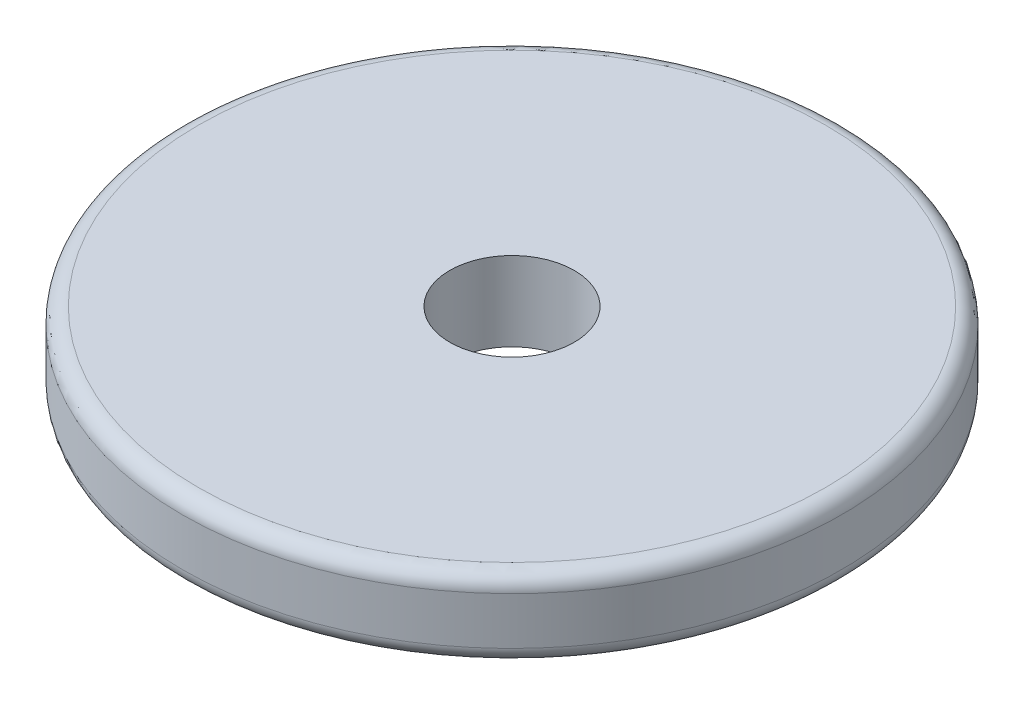
from build123d import *

# Parameters (mm, degrees)
SKETCH1_R           = 15.875
SKETCH1_R_2         = 3
BOSS_EXTRUDE1_DEPTH = 3.81
FILLET1_R           = 0.762


with BuildPart() as part:
    # Sketch1 → Boss-Extrude1 (new body)
    with BuildSketch(Plane(origin=(0, 0, 0), x_dir=(1, 0, 0), z_dir=(0, 1, 0))):
        Circle(SKETCH1_R)
        Circle(SKETCH1_R_2, mode=Mode.SUBTRACT)
    extrude(amount=BOSS_EXTRUDE1_DEPTH)

    # Fillet1
    fillet1_edges = [part.edges().sort_by_distance(p)[0] for p in [
        (-15.875, 0, 0),
        (-15.875, 3.81, 0),
    ]]
    fillet(fillet1_edges, radius=FILLET1_R)


solid = part.part
